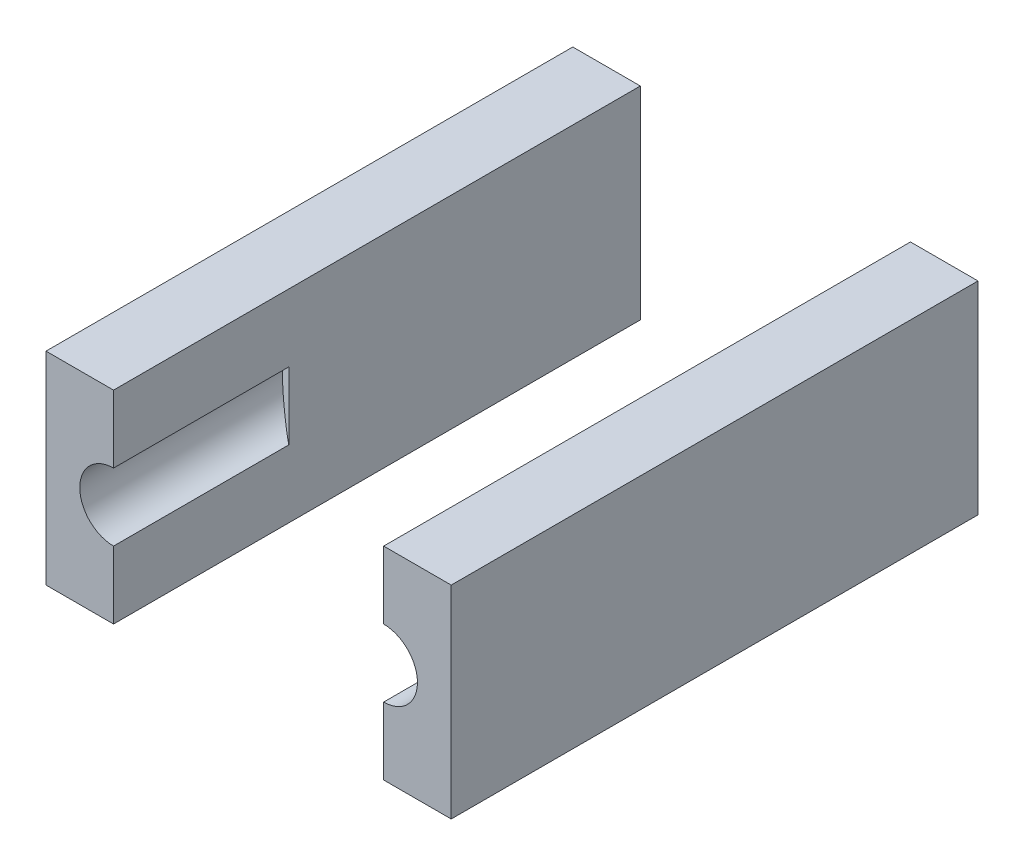
from build123d import *

# Parameters (mm, degrees)
SKETCH1_W             = 10
SKETCH1_H             = 30
BOSS_EXTRUDE2_DEPTH   = 77.999962115
BOSS_EXTRUDE2_2_DEPTH = 77.999962115
CAVITY1_START         = -30
CAVITY1_DEPTH         = 30
CAVITY1_START_2       = -6
CAVITY1_2_DEPTH       = 12
CAVITY1_3_DEPTH       = 30
CAVITY1_4_DEPTH       = 12


with BuildPart() as part:
    # Sketch1 → Boss-Extrude2 (new body)
    with BuildSketch(Plane.XY):
        with Locations((-25, 0)):
            Rectangle(SKETCH1_W, SKETCH1_H)
    extrude(amount=-BOSS_EXTRUDE2_DEPTH)

    # Cavity1 3 outline → Cavity1 3 (cut)
    with BuildSketch(Plane.XY.offset(CAVITY1_START)):
        with BuildLine():
            Line((-20, -5), (-20, 5))
            ThreePointArc((-20, 5), (-25, 0), (-20, -5))
        make_face()
    extrude(amount=CAVITY1_3_DEPTH, mode=Mode.SUBTRACT)

    # Cavity1 4 outline → Cavity1 4 (add)
    with BuildSketch(Plane(origin=(0, 0, 0), x_dir=(1, 0, 0), z_dir=(0, 1, 0)).offset(CAVITY1_START_2)):
        Polygon((-20, 30), (-25, 30), (-20, 25.958039892), align=None)
    extrude(amount=CAVITY1_4_DEPTH)


with BuildPart() as body_2:
    # Sketch1 → Boss-Extrude2 2 (new body)
    with BuildSketch(Plane.XY):
        with Locations((25, 0)):
            Rectangle(SKETCH1_W, SKETCH1_H)
    extrude(amount=-BOSS_EXTRUDE2_2_DEPTH)

    # Cavity1: read off the stored shape, not the designer's step
    # Cavity1 outline → Cavity1 (cut)
    with BuildSketch(Plane.XY.offset(CAVITY1_START)):
        with BuildLine():
            ThreePointArc((20, -5), (25, 0), (20, 5))
            Line((20, 5), (20, -5))
        make_face()
    extrude(amount=CAVITY1_DEPTH, mode=Mode.SUBTRACT)

    # Cavity1 2 outline → Cavity1 2 (add)
    with BuildSketch(Plane(origin=(0, 0, 0), x_dir=(1, 0, 0), z_dir=(0, 1, 0)).offset(CAVITY1_START_2)):
        Polygon((20, 30), (20, 25.958039892), (25, 30), align=None)
    extrude(amount=CAVITY1_2_DEPTH)


solid = Compound([part.part, body_2.part])
